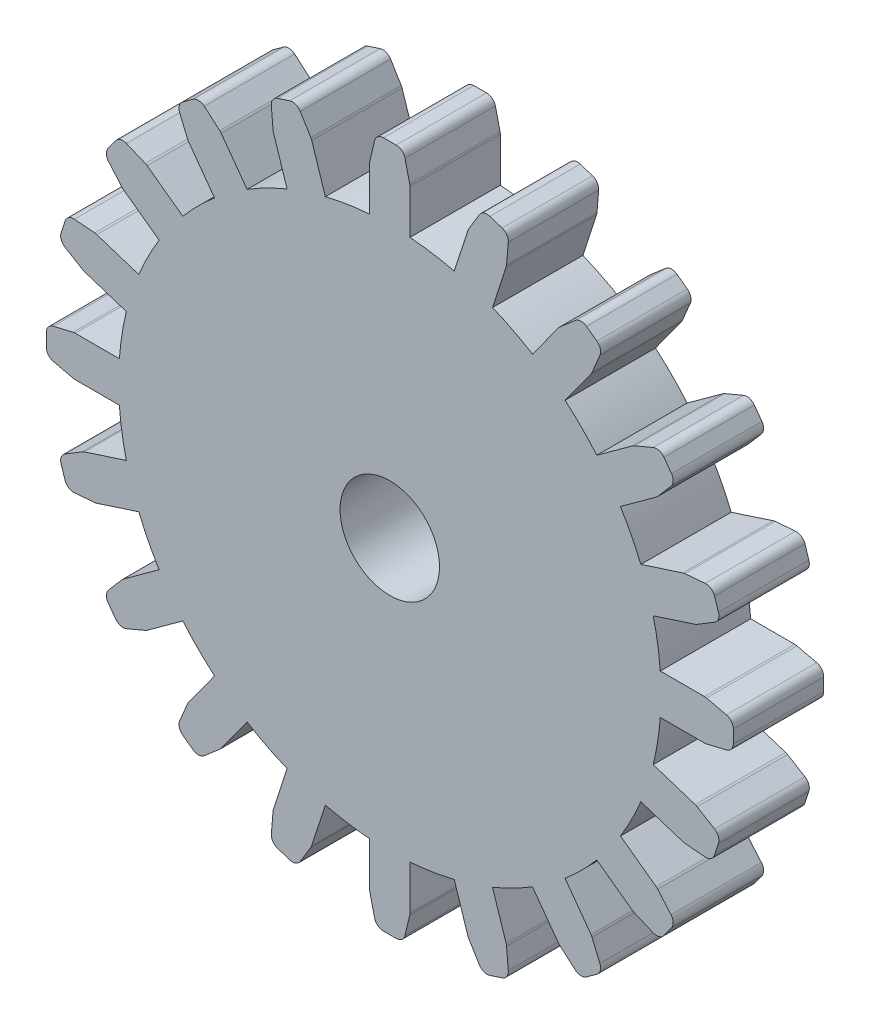
from build123d import *

# Parameters (mm, degrees)
SKETCH1_R           = 2.75
BOSS_EXTRUDE1_DEPTH = 5
FILLET3_R           = 0.5
FILLET4_R           = 0.5
FILLET5_R           = 0.5
FILLET6_R           = 0.5
FILLET7_R           = 0.5
FILLET8_R           = 0.5
FILLET9_R           = 0.5
FILLET10_R          = 0.5
FILLET11_R          = 0.5
FILLET12_R          = 0.5
FILLET13_R          = 0.5
FILLET14_R          = 0.5
FILLET15_R          = 0.5
FILLET16_R          = 0.5
FILLET17_R          = 0.5
FILLET18_R          = 0.5
FILLET19_R          = 0.5
FILLET20_R          = 0.5
FILLET21_R          = 0.5
FILLET22_R          = 0.5
FILLET23_R          = 0.5
FILLET24_R          = 0.5
FILLET25_R          = 0.5
FILLET26_R          = 0.5
FILLET27_R          = 0.5
FILLET28_R          = 0.5
FILLET29_R          = 0.5
FILLET30_R          = 0.5
FILLET31_R          = 0.5
FILLET32_R          = 0.5
FILLET33_R          = 0.5
FILLET34_R          = 0.5
FILLET35_R          = 0.5
FILLET36_R          = 0.5
FILLET37_R          = 0.5
FILLET38_R          = 0.5
FILLET39_R          = 0.5
FILLET40_R          = 0.5
FILLET41_R          = 0.5
FILLET42_R          = 0.5
FILLET43_R          = 0.5
FILLET44_R          = 0.5
FILLET45_R          = 0.5
FILLET46_R          = 0.5
FILLET47_R          = 0.5
FILLET48_R          = 0.5
FILLET49_R          = 0.5
FILLET50_R          = 0.5
FILLET51_R          = 0.5
FILLET52_R          = 0.5
FILLET53_R          = 0.5
FILLET54_R          = 0.5
FILLET55_R          = 0.5
FILLET56_R          = 0.5
FILLET57_R          = 0.5
FILLET58_R          = 0.5
FILLET59_R          = 0.5
FILLET60_R          = 0.5
FILLET61_R          = 0.5
FILLET62_R          = 0.5
FILLET63_R          = 0.5
FILLET64_R          = 0.5
FILLET65_R          = 0.5
FILLET66_R          = 0.5
FILLET67_R          = 0.5
FILLET70_R          = 0.5
FILLET71_R          = 0.5
FILLET72_R          = 0.5
FILLET73_R          = 0.5
FILLET74_R          = 0.5
FILLET75_R          = 0.5
FILLET76_R          = 0.5
FILLET77_R          = 0.5
FILLET78_R          = 0.5
FILLET79_R          = 0.5
FILLET80_R          = 0.5
FILLET81_R          = 0.5
FILLET82_R          = 0.5
FILLET83_R          = 0.5


with BuildPart() as part:
    # Sketch1 → Boss-Extrude1 (new body)
    with BuildSketch(Plane.XY):
        with BuildLine():
            Line((-0.75, 19), (0.75, 19))
            Line((0.75, 19), (1.112671654, 17.458675135))
            Line((1.112671654, 17.458675135), (1.112671654, 14.958675135))
            ThreePointArc((1.112671654, 14.958675135), (2.346516976, 14.815325109), (3.564271203, 14.570379912))
            Line((3.564271203, 14.570379912), (4.336813689, 16.948021203))
            Line((4.336813689, 16.948021203), (5.158030506, 18.301836555))
            Line((5.158030506, 18.301836555), (6.58461528, 17.838311064))
            Line((6.58461528, 17.838311064), (6.453240943, 16.260352303))
            Line((6.453240943, 16.260352303), (5.680698457, 13.882711012))
            ThreePointArc((5.680698457, 13.882711012), (6.809857496, 13.365097863), (7.892318361, 12.755834386))
            Line((7.892318361, 12.755834386), (9.361781492, 14.778376872))
            Line((9.361781492, 14.778376872), (10.561157048, 15.812161832))
            Line((10.561157048, 15.812161832), (11.774682539, 14.930483954))
            Line((11.774682539, 14.930483954), (11.162122046, 13.470352895))
            Line((11.162122046, 13.470352895), (9.692658915, 11.447810409))
            ThreePointArc((9.692658915, 11.447810409), (10.606601718, 10.606601718), (11.447810409, 9.692658915))
            Line((11.447810409, 9.692658915), (13.470352895, 11.162122046))
            Line((13.470352895, 11.162122046), (14.930483954, 11.774682539))
            Line((14.930483954, 11.774682539), (15.812161832, 10.561157048))
            Line((15.812161832, 10.561157048), (14.778376872, 9.361781492))
            Line((14.778376872, 9.361781492), (12.755834386, 7.892318361))
            ThreePointArc((12.755834386, 7.892318361), (13.365097863, 6.809857496), (13.882711012, 5.680698457))
            Line((13.882711012, 5.680698457), (16.260352303, 6.453240943))
            Line((16.260352303, 6.453240943), (17.838311064, 6.58461528))
            Line((17.838311064, 6.58461528), (18.301836555, 5.158030506))
            Line((18.301836555, 5.158030506), (16.948021203, 4.336813689))
            Line((16.948021203, 4.336813689), (14.570379912, 3.564271203))
            ThreePointArc((14.570379912, 3.564271203), (14.815325109, 2.346516976), (14.958675135, 1.112671654))
            Line((14.958675135, 1.112671654), (17.458675135, 1.112671654))
            Line((17.458675135, 1.112671654), (19, 0.75))
            Line((19, 0.75), (19, -0.75))
            Line((19, -0.75), (17.458675135, -1.112671654))
            Line((17.458675135, -1.112671654), (14.958675135, -1.112671654))
            ThreePointArc((14.958675135, -1.112671654), (14.815325109, -2.346516976), (14.570379912, -3.564271203))
            Line((14.570379912, -3.564271203), (16.948021203, -4.336813689))
            Line((16.948021203, -4.336813689), (18.301836555, -5.158030506))
            Line((18.301836555, -5.158030506), (17.838311064, -6.58461528))
            Line((17.838311064, -6.58461528), (16.260352303, -6.453240943))
            Line((16.260352303, -6.453240943), (13.882711012, -5.680698457))
            ThreePointArc((13.882711012, -5.680698457), (13.365097863, -6.809857496), (12.755834386, -7.892318361))
            Line((12.755834386, -7.892318361), (14.778376872, -9.361781492))
            Line((14.778376872, -9.361781492), (15.812161832, -10.561157048))
            Line((15.812161832, -10.561157048), (14.930483954, -11.774682539))
            Line((14.930483954, -11.774682539), (13.470352895, -11.162122046))
            Line((13.470352895, -11.162122046), (11.447810409, -9.692658915))
            ThreePointArc((11.447810409, -9.692658915), (10.606601718, -10.606601718), (9.692658915, -11.447810409))
            Line((9.692658915, -11.447810409), (11.162122046, -13.470352895))
            Line((11.162122046, -13.470352895), (11.774682539, -14.930483954))
            Line((11.774682539, -14.930483954), (10.561157048, -15.812161832))
            Line((10.561157048, -15.812161832), (9.361781492, -14.778376872))
            Line((9.361781492, -14.778376872), (7.892318361, -12.755834386))
            ThreePointArc((7.892318361, -12.755834386), (6.809857496, -13.365097863), (5.680698457, -13.882711012))
            Line((5.680698457, -13.882711012), (6.453240943, -16.260352303))
            Line((6.453240943, -16.260352303), (6.58461528, -17.838311064))
            Line((6.58461528, -17.838311064), (5.158030506, -18.301836555))
            Line((5.158030506, -18.301836555), (4.336813689, -16.948021203))
            Line((4.336813689, -16.948021203), (3.564271203, -14.570379912))
            ThreePointArc((3.564271203, -14.570379912), (2.346516976, -14.815325109), (1.112671654, -14.958675135))
            Line((1.112671654, -14.958675135), (1.112671654, -17.458675135))
            Line((1.112671654, -17.458675135), (0.75, -19))
            Line((0.75, -19), (-0.75, -19))
            Line((-0.75, -19), (-1.112671654, -17.458675135))
            Line((-1.112671654, -17.458675135), (-1.112671654, -14.958675135))
            ThreePointArc((-1.112671654, -14.958675135), (-2.346516976, -14.815325109), (-3.564271203, -14.570379912))
            Line((-3.564271203, -14.570379912), (-4.336813689, -16.948021203))
            Line((-4.336813689, -16.948021203), (-5.158030506, -18.301836555))
            Line((-5.158030506, -18.301836555), (-6.58461528, -17.838311064))
            Line((-6.58461528, -17.838311064), (-6.453240943, -16.260352303))
            Line((-6.453240943, -16.260352303), (-5.680698457, -13.882711012))
            ThreePointArc((-5.680698457, -13.882711012), (-6.809857496, -13.365097863), (-7.892318361, -12.755834386))
            Line((-7.892318361, -12.755834386), (-9.361781492, -14.778376872))
            Line((-9.361781492, -14.778376872), (-10.561157048, -15.812161832))
            Line((-10.561157048, -15.812161832), (-11.774682539, -14.930483954))
            Line((-11.774682539, -14.930483954), (-11.162122046, -13.470352895))
            Line((-11.162122046, -13.470352895), (-9.692658915, -11.447810409))
            ThreePointArc((-9.692658915, -11.447810409), (-10.606601718, -10.606601718), (-11.447810409, -9.692658915))
            Line((-11.447810409, -9.692658915), (-13.470352895, -11.162122046))
            Line((-13.470352895, -11.162122046), (-14.930483954, -11.774682539))
            Line((-14.930483954, -11.774682539), (-15.812161832, -10.561157048))
            Line((-15.812161832, -10.561157048), (-14.778376872, -9.361781492))
            Line((-14.778376872, -9.361781492), (-12.755834386, -7.892318361))
            ThreePointArc((-12.755834386, -7.892318361), (-13.365097863, -6.809857496), (-13.882711012, -5.680698457))
            Line((-13.882711012, -5.680698457), (-16.260352303, -6.453240943))
            Line((-16.260352303, -6.453240943), (-17.838311064, -6.58461528))
            Line((-17.838311064, -6.58461528), (-18.301836555, -5.158030506))
            Line((-18.301836555, -5.158030506), (-16.948021203, -4.336813689))
            Line((-16.948021203, -4.336813689), (-14.570379912, -3.564271203))
            ThreePointArc((-14.570379912, -3.564271203), (-14.815325109, -2.346516976), (-14.958675135, -1.112671654))
            Line((-14.958675135, -1.112671654), (-17.458675135, -1.112671654))
            Line((-17.458675135, -1.112671654), (-19, -0.75))
            Line((-19, -0.75), (-19, 0.75))
            Line((-19, 0.75), (-17.458675135, 1.112671654))
            Line((-17.458675135, 1.112671654), (-14.958675135, 1.112671654))
            ThreePointArc((-14.958675135, 1.112671654), (-14.815325109, 2.346516976), (-14.570379912, 3.564271203))
            Line((-14.570379912, 3.564271203), (-16.948021203, 4.336813689))
            Line((-16.948021203, 4.336813689), (-18.301836555, 5.158030506))
            Line((-18.301836555, 5.158030506), (-17.838311064, 6.58461528))
            Line((-17.838311064, 6.58461528), (-16.260352303, 6.453240943))
            Line((-16.260352303, 6.453240943), (-13.882711012, 5.680698457))
            ThreePointArc((-13.882711012, 5.680698457), (-13.365097863, 6.809857496), (-12.755834386, 7.892318361))
            Line((-12.755834386, 7.892318361), (-14.778376872, 9.361781492))
            Line((-14.778376872, 9.361781492), (-15.812161832, 10.561157048))
            Line((-15.812161832, 10.561157048), (-14.930483954, 11.774682539))
            Line((-14.930483954, 11.774682539), (-13.470352895, 11.162122046))
            Line((-13.470352895, 11.162122046), (-11.447810409, 9.692658915))
            ThreePointArc((-11.447810409, 9.692658915), (-10.606601718, 10.606601718), (-9.692658915, 11.447810409))
            Line((-9.692658915, 11.447810409), (-11.162122046, 13.470352895))
            Line((-11.162122046, 13.470352895), (-11.774682539, 14.930483954))
            Line((-11.774682539, 14.930483954), (-10.561157048, 15.812161832))
            Line((-10.561157048, 15.812161832), (-9.361781492, 14.778376872))
            Line((-9.361781492, 14.778376872), (-7.892318361, 12.755834386))
            ThreePointArc((-7.892318361, 12.755834386), (-6.809857496, 13.365097863), (-5.680698457, 13.882711012))
            Line((-5.680698457, 13.882711012), (-6.453240943, 16.260352303))
            Line((-6.453240943, 16.260352303), (-6.58461528, 17.838311064))
            Line((-6.58461528, 17.838311064), (-5.158030506, 18.301836555))
            Line((-5.158030506, 18.301836555), (-4.336813689, 16.948021203))
            Line((-4.336813689, 16.948021203), (-3.564271203, 14.570379912))
            ThreePointArc((-3.564271203, 14.570379912), (-2.346516976, 14.815325109), (-1.112671654, 14.958675135))
            Line((-1.112671654, 14.958675135), (-1.112671654, 17.458675135))
            Line((-1.112671654, 17.458675135), (-0.75, 19))
        make_face()
        Circle(SKETCH1_R, mode=Mode.SUBTRACT)
    extrude(amount=BOSS_EXTRUDE1_DEPTH)

    # Fillet3
    fillet3_edges = [part.edges().sort_by_distance(p)[0] for p in [
        (0.75, 19, 2.5),
    ]]
    fillet(fillet3_edges, radius=FILLET3_R)

    # Fillet4
    fillet4_edges = [part.edges().sort_by_distance(p)[0] for p in [
        (-0.75, 19, 2.5),
    ]]
    fillet(fillet4_edges, radius=FILLET4_R)

    # Fillet5
    fillet5_edges = [part.edges().sort_by_distance(p)[0] for p in [
        (1.112671654, 17.458675135, 2.5),
    ]]
    fillet(fillet5_edges, radius=FILLET5_R)

    # Fillet6
    fillet6_edges = [part.edges().sort_by_distance(p)[0] for p in [
        (-1.112671654, 17.458675135, 2.5),
    ]]
    fillet(fillet6_edges, radius=FILLET6_R)

    # Fillet7
    fillet7_edges = [part.edges().sort_by_distance(p)[0] for p in [
        (6.58461528, 17.838311064, 2.5),
    ]]
    fillet(fillet7_edges, radius=FILLET7_R)

    # Fillet8
    fillet8_edges = [part.edges().sort_by_distance(p)[0] for p in [
        (5.158030506, 18.301836555, 2.5),
    ]]
    fillet(fillet8_edges, radius=FILLET8_R)

    # Fillet9
    fillet9_edges = [part.edges().sort_by_distance(p)[0] for p in [
        (10.561157048, 15.812161832, 2.5),
    ]]
    fillet(fillet9_edges, radius=FILLET9_R)

    # Fillet10
    fillet10_edges = [part.edges().sort_by_distance(p)[0] for p in [
        (11.774682539, 14.930483954, 2.5),
    ]]
    fillet(fillet10_edges, radius=FILLET10_R)

    # Fillet11
    fillet11_edges = [part.edges().sort_by_distance(p)[0] for p in [
        (15.812161832, 10.561157048, 2.5),
    ]]
    fillet(fillet11_edges, radius=FILLET11_R)

    # Fillet12
    fillet12_edges = [part.edges().sort_by_distance(p)[0] for p in [
        (14.930483954, 11.774682539, 2.5),
    ]]
    fillet(fillet12_edges, radius=FILLET12_R)

    # Fillet13
    fillet13_edges = [part.edges().sort_by_distance(p)[0] for p in [
        (17.838311064, 6.58461528, 2.5),
    ]]
    fillet(fillet13_edges, radius=FILLET13_R)

    # Fillet14
    fillet14_edges = [part.edges().sort_by_distance(p)[0] for p in [
        (18.301836555, 5.158030506, 2.5),
    ]]
    fillet(fillet14_edges, radius=FILLET14_R)

    # Fillet15
    fillet15_edges = [part.edges().sort_by_distance(p)[0] for p in [
        (19, 0.75, 2.5),
    ]]
    fillet(fillet15_edges, radius=FILLET15_R)

    # Fillet16
    fillet16_edges = [part.edges().sort_by_distance(p)[0] for p in [
        (19, -0.75, 2.5),
    ]]
    fillet(fillet16_edges, radius=FILLET16_R)

    # Fillet17
    fillet17_edges = [part.edges().sort_by_distance(p)[0] for p in [
        (18.301836555, -5.158030506, 2.5),
    ]]
    fillet(fillet17_edges, radius=FILLET17_R)

    # Fillet18
    fillet18_edges = [part.edges().sort_by_distance(p)[0] for p in [
        (17.838311064, -6.58461528, 2.5),
    ]]
    fillet(fillet18_edges, radius=FILLET18_R)

    # Fillet19
    fillet19_edges = [part.edges().sort_by_distance(p)[0] for p in [
        (15.812161832, -10.561157048, 2.5),
    ]]
    fillet(fillet19_edges, radius=FILLET19_R)

    # Fillet20
    fillet20_edges = [part.edges().sort_by_distance(p)[0] for p in [
        (14.930483954, -11.774682539, 2.5),
    ]]
    fillet(fillet20_edges, radius=FILLET20_R)

    # Fillet21
    fillet21_edges = [part.edges().sort_by_distance(p)[0] for p in [
        (11.774682539, -14.930483954, 2.5),
    ]]
    fillet(fillet21_edges, radius=FILLET21_R)

    # Fillet22
    fillet22_edges = [part.edges().sort_by_distance(p)[0] for p in [
        (10.561157048, -15.812161832, 2.5),
    ]]
    fillet(fillet22_edges, radius=FILLET22_R)

    # Fillet23
    fillet23_edges = [part.edges().sort_by_distance(p)[0] for p in [
        (6.58461528, -17.838311064, 2.5),
    ]]
    fillet(fillet23_edges, radius=FILLET23_R)

    # Fillet24
    fillet24_edges = [part.edges().sort_by_distance(p)[0] for p in [
        (5.158030506, -18.301836555, 2.5),
    ]]
    fillet(fillet24_edges, radius=FILLET24_R)

    # Fillet25
    fillet25_edges = [part.edges().sort_by_distance(p)[0] for p in [
        (0.75, -19, 2.5),
    ]]
    fillet(fillet25_edges, radius=FILLET25_R)

    # Fillet26
    fillet26_edges = [part.edges().sort_by_distance(p)[0] for p in [
        (-0.75, -19, 2.5),
    ]]
    fillet(fillet26_edges, radius=FILLET26_R)

    # Fillet27
    fillet27_edges = [part.edges().sort_by_distance(p)[0] for p in [
        (-5.158030506, -18.301836555, 2.5),
    ]]
    fillet(fillet27_edges, radius=FILLET27_R)

    # Fillet28
    fillet28_edges = [part.edges().sort_by_distance(p)[0] for p in [
        (-6.58461528, -17.838311064, 2.5),
    ]]
    fillet(fillet28_edges, radius=FILLET28_R)

    # Fillet29
    fillet29_edges = [part.edges().sort_by_distance(p)[0] for p in [
        (-10.561157048, -15.812161832, 2.5),
    ]]
    fillet(fillet29_edges, radius=FILLET29_R)

    # Fillet30
    fillet30_edges = [part.edges().sort_by_distance(p)[0] for p in [
        (-11.774682539, -14.930483954, 2.5),
    ]]
    fillet(fillet30_edges, radius=FILLET30_R)

    # Fillet31
    fillet31_edges = [part.edges().sort_by_distance(p)[0] for p in [
        (-14.930483954, -11.774682539, 2.5),
    ]]
    fillet(fillet31_edges, radius=FILLET31_R)

    # Fillet32
    fillet32_edges = [part.edges().sort_by_distance(p)[0] for p in [
        (-15.812161832, -10.561157048, 2.5),
    ]]
    fillet(fillet32_edges, radius=FILLET32_R)

    # Fillet33
    fillet33_edges = [part.edges().sort_by_distance(p)[0] for p in [
        (-17.838311064, -6.58461528, 2.5),
    ]]
    fillet(fillet33_edges, radius=FILLET33_R)

    # Fillet34
    fillet34_edges = [part.edges().sort_by_distance(p)[0] for p in [
        (-18.301836555, -5.158030506, 2.5),
    ]]
    fillet(fillet34_edges, radius=FILLET34_R)

    # Fillet35
    fillet35_edges = [part.edges().sort_by_distance(p)[0] for p in [
        (-19, -0.75, 2.5),
    ]]
    fillet(fillet35_edges, radius=FILLET35_R)

    # Fillet36
    fillet36_edges = [part.edges().sort_by_distance(p)[0] for p in [
        (-19, 0.75, 2.5),
    ]]
    fillet(fillet36_edges, radius=FILLET36_R)

    # Fillet37
    fillet37_edges = [part.edges().sort_by_distance(p)[0] for p in [
        (-18.301836555, 5.158030506, 2.5),
    ]]
    fillet(fillet37_edges, radius=FILLET37_R)

    # Fillet38
    fillet38_edges = [part.edges().sort_by_distance(p)[0] for p in [
        (-17.838311064, 6.58461528, 2.5),
    ]]
    fillet(fillet38_edges, radius=FILLET38_R)

    # Fillet39
    fillet39_edges = [part.edges().sort_by_distance(p)[0] for p in [
        (-15.812161832, 10.561157048, 2.5),
    ]]
    fillet(fillet39_edges, radius=FILLET39_R)

    # Fillet40
    fillet40_edges = [part.edges().sort_by_distance(p)[0] for p in [
        (-14.930483954, 11.774682539, 2.5),
    ]]
    fillet(fillet40_edges, radius=FILLET40_R)

    # Fillet41
    fillet41_edges = [part.edges().sort_by_distance(p)[0] for p in [
        (-11.774682539, 14.930483954, 2.5),
    ]]
    fillet(fillet41_edges, radius=FILLET41_R)

    # Fillet42
    fillet42_edges = [part.edges().sort_by_distance(p)[0] for p in [
        (-10.561157048, 15.812161832, 2.5),
    ]]
    fillet(fillet42_edges, radius=FILLET42_R)

    # Fillet43
    fillet43_edges = [part.edges().sort_by_distance(p)[0] for p in [
        (-6.58461528, 17.838311064, 2.5),
    ]]
    fillet(fillet43_edges, radius=FILLET43_R)

    # Fillet44
    fillet44_edges = [part.edges().sort_by_distance(p)[0] for p in [
        (-5.158030506, 18.301836555, 2.5),
    ]]
    fillet(fillet44_edges, radius=FILLET44_R)

    # Fillet45
    fillet45_edges = [part.edges().sort_by_distance(p)[0] for p in [
        (4.336813689, 16.948021203, 2.5),
    ]]
    fillet(fillet45_edges, radius=FILLET45_R)

    # Fillet46
    fillet46_edges = [part.edges().sort_by_distance(p)[0] for p in [
        (6.453240943, 16.260352303, 2.5),
    ]]
    fillet(fillet46_edges, radius=FILLET46_R)

    # Fillet47
    fillet47_edges = [part.edges().sort_by_distance(p)[0] for p in [
        (9.361781492, 14.778376872, 2.5),
    ]]
    fillet(fillet47_edges, radius=FILLET47_R)

    # Fillet48
    fillet48_edges = [part.edges().sort_by_distance(p)[0] for p in [
        (11.162122046, 13.470352895, 2.5),
    ]]
    fillet(fillet48_edges, radius=FILLET48_R)

    # Fillet49
    fillet49_edges = [part.edges().sort_by_distance(p)[0] for p in [
        (13.470352895, 11.162122046, 2.5),
    ]]
    fillet(fillet49_edges, radius=FILLET49_R)

    # Fillet50
    fillet50_edges = [part.edges().sort_by_distance(p)[0] for p in [
        (14.778376872, 9.361781492, 2.5),
    ]]
    fillet(fillet50_edges, radius=FILLET50_R)

    # Fillet51
    fillet51_edges = [part.edges().sort_by_distance(p)[0] for p in [
        (16.260352303, 6.453240943, 2.5),
    ]]
    fillet(fillet51_edges, radius=FILLET51_R)

    # Fillet52
    fillet52_edges = [part.edges().sort_by_distance(p)[0] for p in [
        (16.948021203, 4.336813689, 2.5),
    ]]
    fillet(fillet52_edges, radius=FILLET52_R)

    # Fillet53
    fillet53_edges = [part.edges().sort_by_distance(p)[0] for p in [
        (17.458675135, 1.112671654, 2.5),
    ]]
    fillet(fillet53_edges, radius=FILLET53_R)

    # Fillet54
    fillet54_edges = [part.edges().sort_by_distance(p)[0] for p in [
        (17.458675135, -1.112671654, 2.5),
    ]]
    fillet(fillet54_edges, radius=FILLET54_R)

    # Fillet55
    fillet55_edges = [part.edges().sort_by_distance(p)[0] for p in [
        (16.948021203, -4.336813689, 2.5),
    ]]
    fillet(fillet55_edges, radius=FILLET55_R)

    # Fillet56
    fillet56_edges = [part.edges().sort_by_distance(p)[0] for p in [
        (16.260352303, -6.453240943, 2.5),
    ]]
    fillet(fillet56_edges, radius=FILLET56_R)

    # Fillet57
    fillet57_edges = [part.edges().sort_by_distance(p)[0] for p in [
        (14.778376872, -9.361781492, 2.5),
    ]]
    fillet(fillet57_edges, radius=FILLET57_R)

    # Fillet58
    fillet58_edges = [part.edges().sort_by_distance(p)[0] for p in [
        (13.470352895, -11.162122046, 2.5),
    ]]
    fillet(fillet58_edges, radius=FILLET58_R)

    # Fillet59
    fillet59_edges = [part.edges().sort_by_distance(p)[0] for p in [
        (11.162122046, -13.470352895, 2.5),
    ]]
    fillet(fillet59_edges, radius=FILLET59_R)

    # Fillet60
    fillet60_edges = [part.edges().sort_by_distance(p)[0] for p in [
        (9.361781492, -14.778376872, 2.5),
    ]]
    fillet(fillet60_edges, radius=FILLET60_R)

    # Fillet61
    fillet61_edges = [part.edges().sort_by_distance(p)[0] for p in [
        (6.453240943, -16.260352303, 2.5),
    ]]
    fillet(fillet61_edges, radius=FILLET61_R)

    # Fillet62
    fillet62_edges = [part.edges().sort_by_distance(p)[0] for p in [
        (4.336813689, -16.948021203, 2.5),
    ]]
    fillet(fillet62_edges, radius=FILLET62_R)

    # Fillet63
    fillet63_edges = [part.edges().sort_by_distance(p)[0] for p in [
        (-1.112671654, -17.458675135, 2.5),
    ]]
    fillet(fillet63_edges, radius=FILLET63_R)

    # Fillet64
    fillet64_edges = [part.edges().sort_by_distance(p)[0] for p in [
        (1.112671654, -17.458675135, 2.5),
    ]]
    fillet(fillet64_edges, radius=FILLET64_R)

    # Fillet65
    fillet65_edges = [part.edges().sort_by_distance(p)[0] for p in [
        (-4.336813689, -16.948021203, 2.5),
    ]]
    fillet(fillet65_edges, radius=FILLET65_R)

    # Fillet66
    fillet66_edges = [part.edges().sort_by_distance(p)[0] for p in [
        (-6.453240943, -16.260352303, 2.5),
    ]]
    fillet(fillet66_edges, radius=FILLET66_R)

    # Fillet67
    fillet67_edges = [part.edges().sort_by_distance(p)[0] for p in [
        (-9.361781492, -14.778376872, 2.5),
    ]]
    fillet(fillet67_edges, radius=FILLET67_R)

    # Fillet70
    fillet70_edges = [part.edges().sort_by_distance(p)[0] for p in [
        (-13.470352895, -11.162122046, 2.5),
    ]]
    fillet(fillet70_edges, radius=FILLET70_R)

    # Fillet71
    fillet71_edges = [part.edges().sort_by_distance(p)[0] for p in [
        (-14.778376872, -9.361781492, 2.5),
    ]]
    fillet(fillet71_edges, radius=FILLET71_R)

    # Fillet72
    fillet72_edges = [part.edges().sort_by_distance(p)[0] for p in [
        (-16.260352303, -6.453240943, 2.5),
    ]]
    fillet(fillet72_edges, radius=FILLET72_R)

    # Fillet73
    fillet73_edges = [part.edges().sort_by_distance(p)[0] for p in [
        (-16.948021203, -4.336813689, 2.5),
    ]]
    fillet(fillet73_edges, radius=FILLET73_R)

    # Fillet74
    fillet74_edges = [part.edges().sort_by_distance(p)[0] for p in [
        (-17.458675135, 1.112671654, 2.5),
    ]]
    fillet(fillet74_edges, radius=FILLET74_R)

    # Fillet75
    fillet75_edges = [part.edges().sort_by_distance(p)[0] for p in [
        (-17.458675135, -1.112671654, 2.5),
    ]]
    fillet(fillet75_edges, radius=FILLET75_R)

    # Fillet76
    fillet76_edges = [part.edges().sort_by_distance(p)[0] for p in [
        (-16.948021203, 4.336813689, 2.5),
    ]]
    fillet(fillet76_edges, radius=FILLET76_R)

    # Fillet77
    fillet77_edges = [part.edges().sort_by_distance(p)[0] for p in [
        (-16.260352303, 6.453240943, 2.5),
    ]]
    fillet(fillet77_edges, radius=FILLET77_R)

    # Fillet78
    fillet78_edges = [part.edges().sort_by_distance(p)[0] for p in [
        (-14.778376872, 9.361781492, 2.5),
    ]]
    fillet(fillet78_edges, radius=FILLET78_R)

    # Fillet79
    fillet79_edges = [part.edges().sort_by_distance(p)[0] for p in [
        (-13.470352895, 11.162122046, 2.5),
    ]]
    fillet(fillet79_edges, radius=FILLET79_R)

    # Fillet80
    fillet80_edges = [part.edges().sort_by_distance(p)[0] for p in [
        (-11.162122046, 13.470352895, 2.5),
    ]]
    fillet(fillet80_edges, radius=FILLET80_R)

    # Fillet81
    fillet81_edges = [part.edges().sort_by_distance(p)[0] for p in [
        (-9.361781492, 14.778376872, 2.5),
    ]]
    fillet(fillet81_edges, radius=FILLET81_R)

    # Fillet82
    fillet82_edges = [part.edges().sort_by_distance(p)[0] for p in [
        (-6.453240943, 16.260352303, 2.5),
    ]]
    fillet(fillet82_edges, radius=FILLET82_R)

    # Fillet83
    fillet83_edges = [part.edges().sort_by_distance(p)[0] for p in [
        (-4.336813689, 16.948021203, 2.5),
    ]]
    fillet(fillet83_edges, radius=FILLET83_R)


solid = part.part
